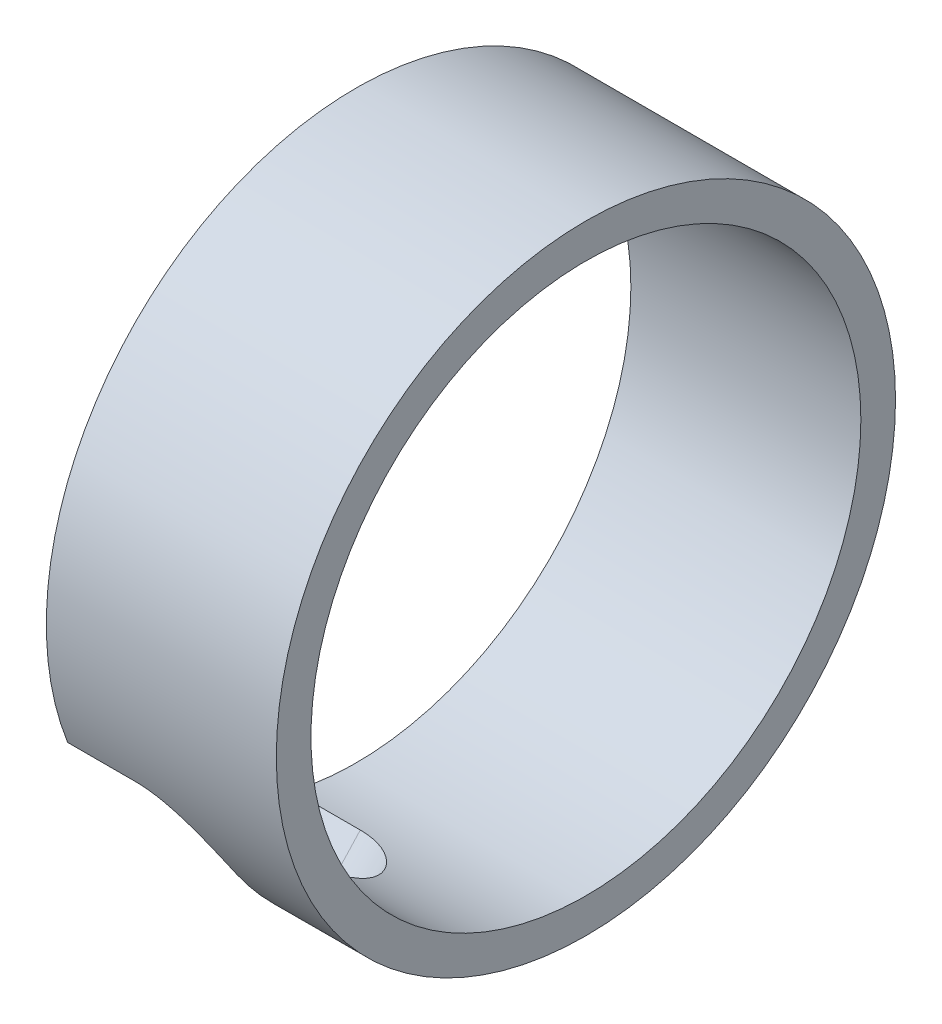
from build123d import *

# Parameters (mm, degrees)
SKETCH1_W          = 6.485999982
SKETCH1_H          = 0.977250014
CUT_EXTRUDE1_REACH = 42.92


with BuildPart() as part:
    # Sketch1 → Revolve1 (revolve)
    with BuildSketch(Plane.XY):
        with Locations((-35.769999961, 8.242624993)):
            Rectangle(SKETCH1_W, SKETCH1_H)
    revolve(axis=Axis((0, 0, 0), (-1, 0, 0)))

    # Sketch3 → Cut-Extrude1 (cut, up to next)
    with BuildSketch(Plane(origin=(0, 0, 0), x_dir=(1, 0, 0), z_dir=(0, -0.7346917137139609, 0.6784011245568831)), mode=Mode.PRIVATE) as cut_extrude1_sk1:
        with BuildLine():
            Line((-39.012999952, 3.81), (-39.012999952, -3.81))
            Line((-39.012999952, -3.81), (-37.107999952, -3.81))
            ThreePointArc((-37.107999952, -3.81), (-35.760961534, -3.252038418), (-35.202999952, -1.905))
            Line((-35.202999952, -1.905), (-35.202999952, 1.905))
            ThreePointArc((-35.202999952, 1.905), (-35.760961534, 3.252038418), (-37.107999952, 3.81))
            Line((-37.107999952, 3.81), (-39.012999952, 3.81))
        make_face()
    cut_extrude1_tool1 = extrude(cut_extrude1_sk1.sketch, amount=CUT_EXTRUDE1_REACH, mode=Mode.PRIVATE) & part.part
    add(cut_extrude1_tool1.solids().sort_by_distance((-37.191875, 0, 0))[0], mode=Mode.SUBTRACT)


solid = part.part
